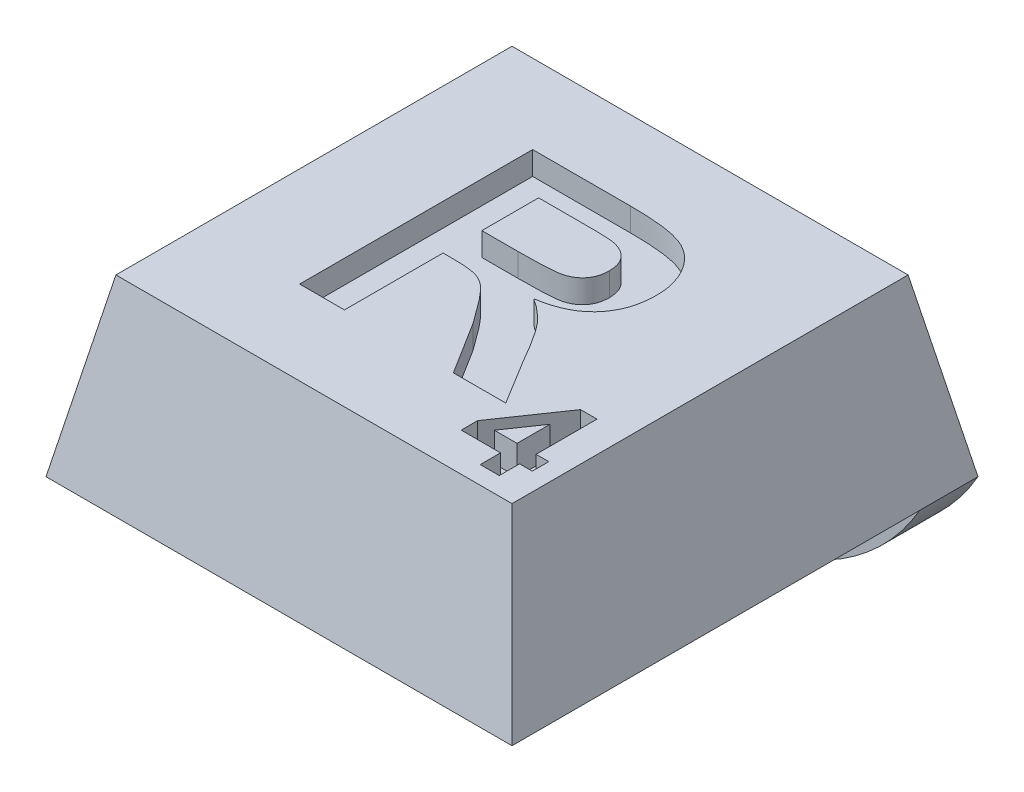
from build123d import *

# Parameters (mm, degrees)
SKETCH1_W               = 8
SKETCH1_H               = 8
BOSS_EXTRUDE1_DEPTH     = 3
CUT_EXTRUDE1_DEPTH      = 12.704699911
CUT_EXTRUDE1_DEPTH_BACK = 12.704699911
CUT_EXTRUDE2_DEPTH      = 11
SKETCH4_R               = 1.75
CUT_EXTRUDE3_DEPTH      = 0.4
SKETCH5_W               = 8
SKETCH5_H               = 1
BOSS_EXTRUDE2_DEPTH     = 2
FILLET1_R               = 4
CUT_EXTRUDE4_DEPTH      = 0.4
CUT_EXTRUDE5_DEPTH      = 0.5


with BuildPart() as part:
    # Sketch1 → Boss-Extrude1 (new body)
    with BuildSketch(Plane(origin=(0, 0, 0), x_dir=(1, 0, 0), z_dir=(0, 1, 0))):
        with Locations((4, 4)):
            Rectangle(SKETCH1_W, SKETCH1_H)
    extrude(amount=BOSS_EXTRUDE1_DEPTH)

    # Sketch2 → Cut-Extrude1 (cut, two sides: drawn at the far end of the back side and taken through both)
    with BuildSketch(Plane.XY.offset(-CUT_EXTRUDE1_DEPTH_BACK)):
        Polygon((0, 0), (0.6, 3), (0, 3), align=None)
        Polygon((8, 0), (7.4, 3), (8, 3), align=None)
    extrude(amount=CUT_EXTRUDE1_DEPTH + CUT_EXTRUDE1_DEPTH_BACK, mode=Mode.SUBTRACT)

    # Sketch3 → Cut-Extrude2 (cut)
    with BuildSketch(Plane(origin=(0, 0, 0), x_dir=(0, 0, -1), z_dir=(1, 0, 0))):
        Polygon((0, 0), (0.6, 3), (0, 3), align=None)
        Polygon((8, 3), (7.4, 3), (8, 0), align=None)
    extrude(amount=CUT_EXTRUDE2_DEPTH, mode=Mode.SUBTRACT)

    # Sketch4 → Cut-Extrude3 (cut)
    with BuildSketch(Plane.XZ):
        with Locations(Location((4, -3.75, 0), (0, 0, 270))):
            Circle(SKETCH4_R)
    extrude(amount=-CUT_EXTRUDE3_DEPTH, mode=Mode.SUBTRACT)

    # Sketch5 → Boss-Extrude2 (add)
    with BuildSketch(Plane.XZ):
        with Locations((4, -7.5)):
            Rectangle(SKETCH5_W, SKETCH5_H)
    extrude(amount=BOSS_EXTRUDE2_DEPTH)

    # Fillet1
    # the kernel refuses this fillet: 4 mm, written as the material it takes off along each edge
    with BuildSketch(Plane(origin=(8, -2, -16.660254038), x_dir=(0, 1, 0), z_dir=(0, 0, 1)), Plane(origin=(0, -2, 1.660254038), x_dir=(0, 1, 0), z_dir=(0, 0, -1))) as fillet1_piece_1:
        with BuildLine():
            CenterArc((4, 3.464101615), FILLET1_R, 180, 60)
            Line((0, 3.464101615), (-0.08, 3.464101615))
            Line((-0.08, 3.464101615), (-0.08, 0))
            Line((-0.08, 0), (0, -0.08))
            ThreePointArc((0, -0.08), (1, -0.08), (1.96, -0.069282032))
            Line((1.96, -0.069282032), (2, 0))
        make_face()
    extrude(amount=18.320508076, mode=Mode.SUBTRACT)

    # Sketch6 → Cut-Extrude4 (cut)
    with BuildSketch(Plane(origin=(0, 3, 0), x_dir=(1, 0, 0), z_dir=(0, 1, 0))):
        with BuildLine():
            Line((2.312898911, 2.041410717), (2.312898911, 6.041410717))
            Line((2.312898911, 6.041410717), (3.991584808, 6.041410717))
            add(Edge.make_bspline(
                [(3.991584808, 6.041410717), (4.042601732, 6.041096301), (4.140920681, 6.040490364), (4.283109063, 6.036071747), (4.414238667, 6.026814487), (4.534891188, 6.016330564), (4.644487122, 6.001077132), (4.74345979, 5.982803671), (4.831642566, 5.961627249), (4.910322089, 5.936265049), (4.982061831, 5.90723713), (5.04889092, 5.87268574), (5.111544162, 5.83220454), (5.170983849, 5.787188805), (5.227461685, 5.737569368), (5.279429347, 5.682033053), (5.32779225, 5.621406813), (5.372511371, 5.556195062), (5.411906117, 5.48668575), (5.447902572, 5.415111184), (5.477205044, 5.340709703), (5.50140862, 5.263831792), (5.52074281, 5.184644366), (5.534162371, 5.102946099), (5.542540058, 5.018884869), (5.543287935, 4.962103945), (5.543668142, 4.93323764)],
                knots=[0, 0, 0, 0, 1.675828044, 3.229627355, 4.67171229, 5.993455049, 7.206927059, 8.304770529, 9.29850117, 10.183580433, 11.017754134, 11.837875825, 12.650738409, 13.464925643, 14.285328857, 15.117007378, 15.959673368, 16.830859064, 17.711229498, 18.58228265, 19.460420693, 20.334473227, 21.228207035, 22.135446768, 23.052097822, 24, 24, 24, 24], degree=3))
            add(Edge.make_bspline(
                [(5.543668142, 4.93323764), (5.542962916, 4.896874176), (5.541584712, 4.825809944), (5.528901745, 4.721651895), (5.5100643, 4.622136315), (5.483211668, 4.527125334), (5.446289845, 4.437736414), (5.403428122, 4.352717347), (5.352308317, 4.272356517), (5.293277733, 4.19745058), (5.226389218, 4.127933229), (5.151349641, 4.065235076), (5.06869476, 4.009111084), (4.977924564, 3.959884897), (4.879671091, 3.917801842), (4.77350828, 3.882394441), (4.659916733, 3.853576761), (4.580902516, 3.840017181), (4.540463013, 3.833077384)],
                knots=[0, 0, 0, 0, 1.05911256, 2.069797862, 3.05271628, 4.008392045, 4.940519534, 5.866323021, 6.779546087, 7.71056835, 8.640711998, 9.585328432, 10.554502533, 11.547017206, 12.589327225, 13.664782803, 14.804835066, 16, 16, 16, 16], degree=3))
            add(Edge.make_bspline(
                [(4.540463013, 3.833077384), (4.579572554, 3.807174767), (4.656115253, 3.756479818), (4.762017587, 3.672984601), (4.857092756, 3.585349912), (4.929078878, 3.507419696), (4.984392794, 3.438888442), (5.028929947, 3.378950347), (5.076970406, 3.309970293), (5.128042999, 3.231910907), (5.183657562, 3.145462828), (5.241745689, 3.049302835), (5.303522957, 2.944368887), (5.345058377, 2.871067212), (5.366584808, 2.833077384)],
                knots=[0, 0, 0, 0, 1.285445069, 2.515791127, 3.691898215, 4.826622834, 5.420063933, 6.105349801, 6.873086501, 7.723915395, 8.66222816, 9.690593598, 10.803111229, 12, 12, 12, 12], degree=3))
            Line((5.366584808, 2.833077384), (5.851360449, 2.041410717))
            Line((5.851360449, 2.041410717), (4.952321988, 2.041410717))
            Line((4.952321988, 2.041410717), (4.383411731, 2.949263281))
            add(Edge.make_bspline(
                [(4.383411731, 2.949263281), (4.357283981, 2.985622121), (4.307400733, 3.055038622), (4.235391184, 3.153681722), (4.169508837, 3.241491798), (4.111507042, 3.319740728), (4.058450932, 3.386209972), (4.011951502, 3.442057857), (3.972955886, 3.488482798), (3.928832249, 3.534515131), (3.877499082, 3.581823547), (3.813952721, 3.627691749), (3.748696505, 3.664257396), (3.678779681, 3.692157844), (3.597922987, 3.71161189), (3.500720436, 3.724006591), (3.384115753, 3.733151261), (3.299833928, 3.733519777), (3.254405321, 3.73371841)],
                knots=[0, 0, 0, 0, 1.465447777, 2.797841088, 3.997266218, 5.05856206, 5.985598736, 6.780315439, 7.437430484, 7.969193402, 8.866571936, 9.718200644, 10.52825214, 11.309096006, 12.174169268, 13.242355782, 14.513606761, 16, 16, 16, 16], degree=3))
            Line((3.254405321, 3.73371841), (3.08212968, 3.73371841))
            Line((3.08212968, 3.73371841), (3.08212968, 2.041410717))
            Line((3.08212968, 2.041410717), (2.312898911, 2.041410717))
        make_face()
        with BuildLine():
            Line((3.08212968, 4.400385076), (3.701520706, 4.400385076))
            add(Edge.make_bspline(
                [(3.701520706, 4.400385076), (3.749332843, 4.400487541), (3.840423044, 4.400682752), (3.969955122, 4.403510317), (4.085670885, 4.405910235), (4.186877859, 4.411940131), (4.274028855, 4.417916326), (4.346774263, 4.425683211), (4.405726987, 4.434863419), (4.464610849, 4.449136231), (4.52492793, 4.474003789), (4.589214527, 4.509422512), (4.644158691, 4.555370201), (4.691753027, 4.608490376), (4.728060837, 4.670937972), (4.756498441, 4.739930879), (4.770916908, 4.817002181), (4.773239296, 4.87042263), (4.774437372, 4.89798123)],
                knots=[0, 0, 0, 0, 1.697953026, 3.23488743, 4.60134403, 5.807846676, 6.835100678, 7.703488618, 8.405232423, 8.952775585, 9.851109663, 10.713519226, 11.549115941, 12.382556273, 13.233359028, 14.101746968, 15.020727134, 16, 16, 16, 16], degree=3))
            add(Edge.make_bspline(
                [(4.774437372, 4.89798123), (4.773074786, 4.928811222), (4.770445895, 4.98829272), (4.749714088, 5.072935459), (4.713527564, 5.147705664), (4.663829732, 5.212726785), (4.601441933, 5.267631557), (4.527131165, 5.311213996), (4.441449505, 5.343672387), (4.379650359, 5.355659208), (4.347354039, 5.361923538)],
                knots=[0, 0, 0, 0, 1.062977961, 2.050844577, 2.982300261, 3.90936959, 4.856017476, 5.831122378, 6.86654153, 8, 8, 8, 8], degree=3))
            add(Edge.make_bspline(
                [(4.347354039, 5.361923538), (4.336678458, 5.363096555), (4.311375089, 5.365876852), (4.266692338, 5.367662514), (4.20955971, 5.370407271), (4.139285669, 5.371528992), (4.056498042, 5.373495271), (3.960867626, 5.373856329), (3.852698247, 5.375009885), (3.776307493, 5.374835906), (3.735975834, 5.374744051)],
                knots=[0, 0, 0, 0, 0.42127143, 0.998501726, 1.753681744, 2.66564073, 3.755712164, 5.002818897, 6.417592707, 8, 8, 8, 8], degree=3))
            Line((3.735975834, 5.374744051), (3.08212968, 5.374744051))
            Line((3.08212968, 5.374744051), (3.08212968, 4.400385076))
        make_face(mode=Mode.SUBTRACT)
    extrude(amount=-CUT_EXTRUDE4_DEPTH, mode=Mode.SUBTRACT)

    # Sketch7 → Cut-Extrude5 (cut)
    with BuildSketch(Plane(origin=(0, 3, 0), x_dir=(1, 0, 0), z_dir=(0, 1, 0))):
        Polygon((6.546707708, 0.907912363), (6.546707708, 1.256630312), (5.871066683, 1.256630312), (5.871066683, 1.53894201), (6.589956907, 2.586117491), (6.873630785, 2.586117491), (6.873630785, 1.539963645), (7.091579503, 1.539963645), (7.091579503, 1.256630312), (6.873630785, 1.256630312), (6.873630785, 0.907912363), align=None)
        Polygon((6.546707708, 1.539963645), (6.546707708, 2.105949222), (6.157805465, 1.539963645), align=None, mode=Mode.SUBTRACT)
    extrude(amount=-CUT_EXTRUDE5_DEPTH, mode=Mode.SUBTRACT)


solid = part.part
